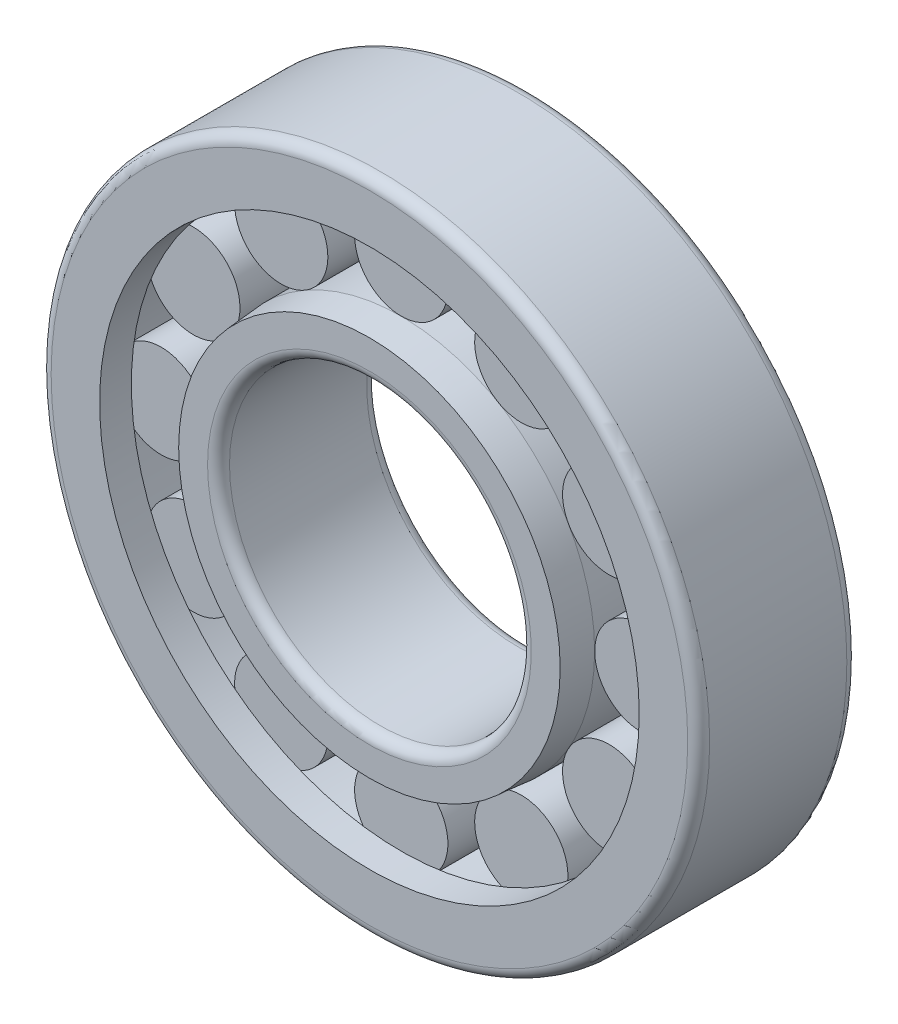
from build123d import *

# Parameters (mm, degrees)
BASESKE_W            = 17.4
BASESKE_H            = 8.5
FILLET1_R            = 2
CIRPATTERNBALL_COUNT = 12


with BuildPart() as part:
    # BaseSke → Roller (revolve)
    with BuildSketch(Plane(origin=(0, 0, 0), x_dir=(0, 0, -1), z_dir=(1, 0, 0))):
        with Locations((0, 39.5)):
            Rectangle(BASESKE_W, BASESKE_H)
    roller = revolve(axis=Axis((0, 43.75, 8.7), (0, 0, -1)))

    # OuterRaceSke → OuterRace (revolve)
    with BuildSketch(Plane(origin=(0, 0, 0), x_dir=(0, 0, -1), z_dir=(1, 0, 0))):
        Polygon((-14.5, 60), (14.5, 60), (14.5, 49.166666667), (8.725, 49.166666667), (8.725, 52.23), (-8.725, 52.23), (-8.725, 49.166666667), (-14.5, 49.166666667), align=None)
    revolve(axis=Axis((0, 0, 50.391616343), (0, 0, -1)))

    # InnerRaceSke → InnerRace (revolve)
    with BuildSketch(Plane(origin=(0, 0, 0), x_dir=(0, 0, -1), z_dir=(1, 0, 0))):
        Polygon((-14.5, 27.5), (14.5, 27.5), (14.5, 38.333333333), (8.725, 38.333333333), (8.725, 35.27), (-8.725, 35.27), (-8.725, 38.333333333), (-14.5, 38.333333333), align=None)
    revolve(axis=Axis((0, 0, 70.862590906), (0, 0, -1)))

    # Fillet1
    fillet1_edges = [part.edges().sort_by_distance(p)[0] for p in [
        (0, -27.5, 14.5),
        (0, -60, -14.5),
        (0, -60, 14.5),
        (0, -27.5, -14.5),
    ]]
    fillet(fillet1_edges, radius=FILLET1_R)

    # NJSke → NJ (revolve, cut)
    with BuildSketch(Plane(origin=(0, 0, 0), x_dir=(0, 0, -1), z_dir=(1, 0, 0))):
        Polygon((14.5, 38.333333333), (8.725, 38.333333333), (8.725, 35.27), (14.5, 34.764752968), align=None)
    nj = revolve(axis=Axis((0, 0, 35.607790457), (0, 0, -1)), mode=Mode.SUBTRACT)

    # NU: NJ across plane
    add(nj.mirror(Plane.XY), mode=Mode.SUBTRACT)

    # CirPatternBall: Roller ×12 about axis
    cirpatternball_axis = Axis((0, 0, 50.391616343), (0, 0, -1))
    for i in range(1, CIRPATTERNBALL_COUNT):
        add(roller.rotate(cirpatternball_axis, i * 360 / CIRPATTERNBALL_COUNT))


solid = part.part
